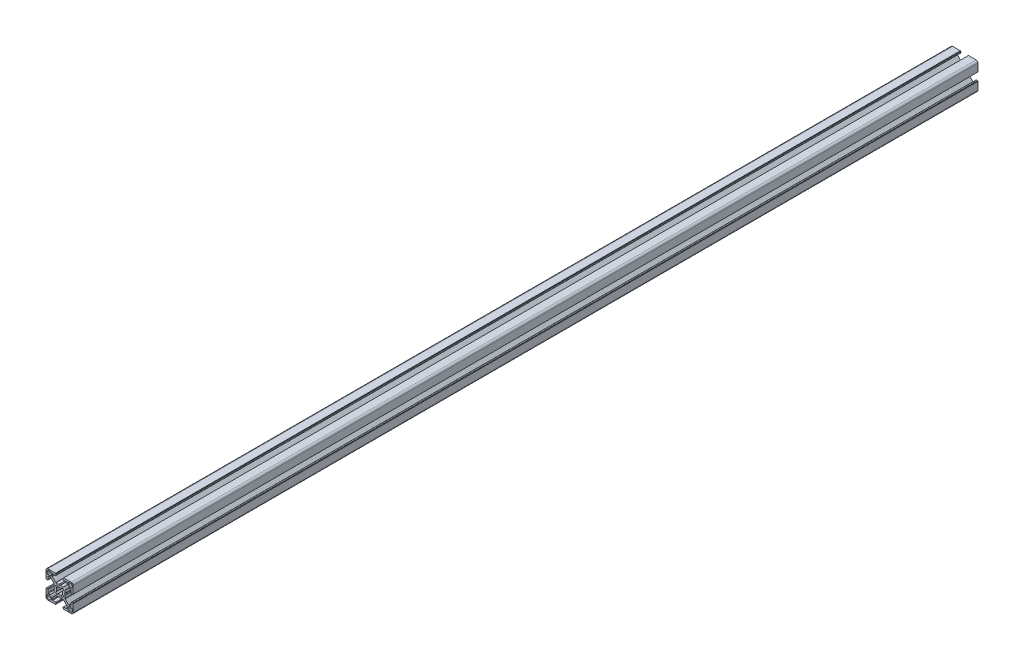
from build123d import *

# Parameters (mm, degrees)
BOSS_EXTRUDE1_DEPTH = 500
CIRPATTERN1_COUNT   = 4


with BuildPart() as part:
    # Sketch3 → Boss-Extrude1 (new, symmetric)
    with BuildSketch(Plane.XY):
        with BuildLine():
            Line((-4.503841895, 3.156803476), (-3.14772708, 1.530298739))
            ThreePointArc((-3.14772708, 1.530298739), (-3.410794979, 0.785160882), (-3.5, 0))
            Line((-3.5, 0), (-5.5, 0))
            Line((-5.5, 0), (-6, 0.866025404))
            Line((-6, 0.866025404), (-6, 3.996841995))
            ThreePointArc((-6, 3.996841995), (-6.038060234, 4.188183711), (-6.146446609, 4.350395385))
            Line((-6.146446609, 4.350395385), (-9.917104615, 8.121053391))
            ThreePointArc((-9.917104615, 8.121053391), (-10.079316289, 8.229439766), (-10.270658005, 8.2675))
            Line((-10.270658005, 8.2675), (-12.29, 8.2675))
            ThreePointArc((-12.29, 8.2675), (-12.643553391, 8.121053391), (-12.79, 7.7675))
            Line((-12.79, 7.7675), (-12.79, 4.5))
            ThreePointArc((-12.79, 4.5), (-12.936446609, 4.146446609), (-13.29, 4))
            Line((-13.29, 4), (-14.5, 4))
            Line((-14.5, 4), (-14.5, 4.5))
            Line((-14.5, 4.5), (-15, 4.5))
            Line((-15, 4.5), (-15, 12.968))
            ThreePointArc((-15, 12.968), (-14.404840979, 14.404840979), (-12.968, 15))
            Line((-12.968, 15), (-4.5, 15))
            Line((-4.5, 15), (-4.5, 14.5))
            Line((-4.5, 14.5), (-4, 14.5))
            Line((-4, 14.5), (-4, 13.29))
            ThreePointArc((-4, 13.29), (-4.146446609, 12.936446609), (-4.5, 12.79))
            Line((-4.5, 12.79), (-7.7675, 12.79))
            ThreePointArc((-7.7675, 12.79), (-8.121053391, 12.643553391), (-8.2675, 12.29))
            Line((-8.2675, 12.29), (-8.2675, 10.270658005))
            ThreePointArc((-8.2675, 10.270658005), (-8.229439766, 10.079316289), (-8.121053391, 9.917104615))
            Line((-8.121053391, 9.917104615), (-4.350395385, 6.146446609))
            ThreePointArc((-4.350395385, 6.146446609), (-4.188183711, 6.038060234), (-3.996841995, 6))
            Line((-3.996841995, 6), (-0.866025404, 6))
            Line((-0.866025404, 6), (0, 5.5))
            Line((0, 5.5), (0, 3.5))
            ThreePointArc((0, 3.5), (-0.785160882, 3.410794979), (-1.530298739, 3.14772708))
            Line((-1.530298739, 3.14772708), (-3.156803476, 4.503841895))
            ThreePointArc((-3.156803476, 4.503841895), (-3.889087297, 3.889087297), (-4.503841895, 3.156803476))
        make_face()
        with BuildLine():
            Line((-12.705, 9.5135), (-10.5135, 9.5135))
            ThreePointArc((-10.5135, 9.5135), (-9.806393219, 9.806393219), (-9.5135, 10.5135))
            Line((-9.5135, 10.5135), (-9.5135, 12.705))
            ThreePointArc((-9.5135, 12.705), (-9.806393219, 13.412106781), (-10.5135, 13.705))
            Line((-10.5135, 13.705), (-12.705, 13.705))
            ThreePointArc((-12.705, 13.705), (-13.412106781, 13.412106781), (-13.705, 12.705))
            Line((-13.705, 12.705), (-13.705, 10.5135))
            ThreePointArc((-13.705, 10.5135), (-13.412106781, 9.806393219), (-12.705, 9.5135))
        make_face(mode=Mode.SUBTRACT)
    boss_extrude1 = extrude(amount=BOSS_EXTRUDE1_DEPTH, both=True)

    # CirPattern1: Boss-Extrude1 ×4 about axis
    cirpattern1_axis = Axis((0, 0, 76.2), (0, 0, -1))
    for i in range(1, CIRPATTERN1_COUNT):
        add(boss_extrude1.rotate(cirpattern1_axis, i * 360 / CIRPATTERN1_COUNT))


solid = part.part
